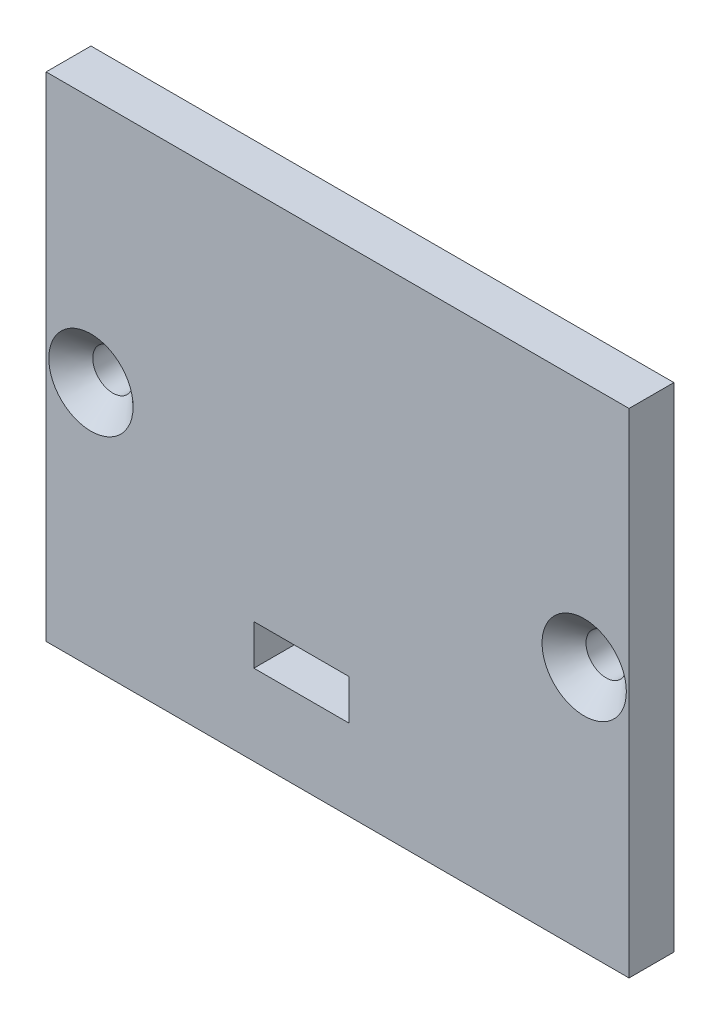
from build123d import *

# Parameters (mm, degrees)
ESQUISSE1_W                                    = 65
ESQUISSE1_H                                    = 55
BOSS_EXTRU_1_DEPTH                             = 5
ESQUISSE2_R                                    = 2
ENL_V_MAT_EXTRU_1_DEPTH                        = 86.293610546
FRAISAGE_POUR_VIS_T_TE_FRAIS_E_M41_D           = 4.5
FRAISAGE_POUR_VIS_T_TE_FRAIS_E_M41_CSINK_D     = 9.4
FRAISAGE_POUR_VIS_T_TE_FRAIS_E_M41_CSINK_ANGLE = 90
ESQUISSE6_W                                    = 10.600064569
ESQUISSE6_H                                    = 4.5
ENL_V_MAT_EXTRU_2_DEPTH                        = 86.293610546


with BuildPart() as part:
    # Esquisse1 → Boss.-Extru.1 (new body)
    with BuildSketch(Plane.XY):
        with Locations((32.5, 27.5)):
            Rectangle(ESQUISSE1_W, ESQUISSE1_H)
    extrude(amount=BOSS_EXTRU_1_DEPTH)

    # Esquisse2 → Enlèv. mat.-Extru.1 (cut, through all)
    with BuildSketch(Plane.XY.offset(5)):
        with Locations((5, 27.5)):
            Circle(ESQUISSE2_R)
        with Locations((60, 27.5)):
            Circle(ESQUISSE2_R)
    extrude(amount=-ENL_V_MAT_EXTRU_1_DEPTH, mode=Mode.SUBTRACT)

    # Fraisage pour vis à tête fraisée M41 (through all)
    with Locations(Plane.XY.offset(5)):
        with Locations((5, 27.5), (60, 27.5)):
            CounterSinkHole(FRAISAGE_POUR_VIS_T_TE_FRAIS_E_M41_D / 2, FRAISAGE_POUR_VIS_T_TE_FRAIS_E_M41_CSINK_D / 2, counter_sink_angle=FRAISAGE_POUR_VIS_T_TE_FRAIS_E_M41_CSINK_ANGLE)

    # Esquisse6 → Enlèv. mat.-Extru.2 (cut, through all)
    with BuildSketch(Plane.XY.offset(5)):
        with Locations((28.468386436, 11.25)):
            Rectangle(ESQUISSE6_W, ESQUISSE6_H)
    extrude(amount=-ENL_V_MAT_EXTRU_2_DEPTH, mode=Mode.SUBTRACT)


solid = part.part
